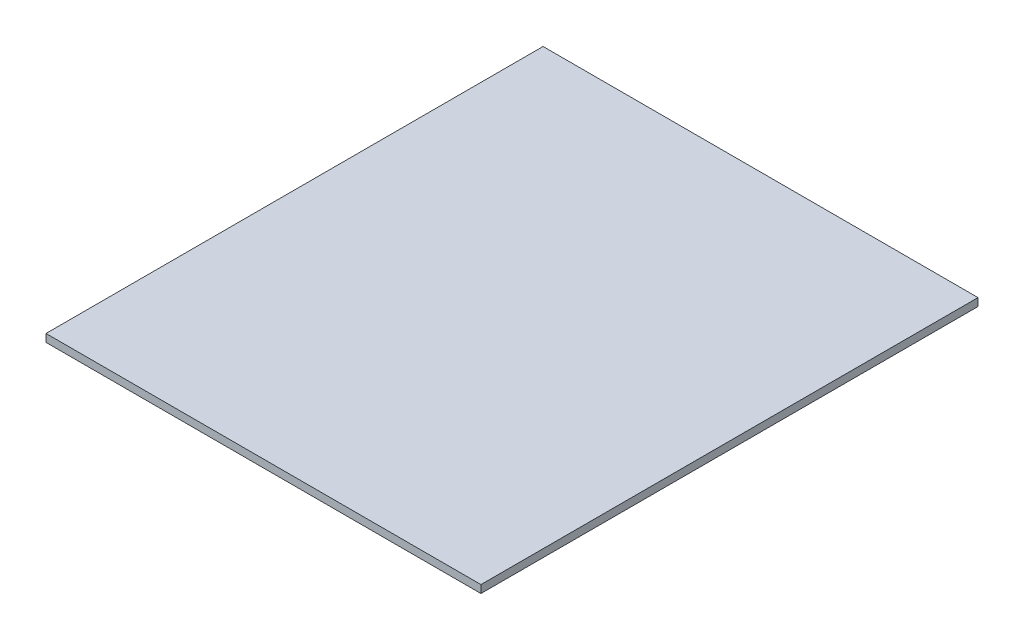
from build123d import *

# Parameters (mm, degrees)
SKETCH1_W           = 355.6
SKETCH1_H           = 406.4
BOSS_EXTRUDE1_DEPTH = 6.35


with BuildPart() as part:
    # Sketch1 → Boss-Extrude1 (new body)
    with BuildSketch(Plane(origin=(0, 0, 0), x_dir=(1, 0, 0), z_dir=(0, 1, 0))):
        with Locations((177.8, 203.2)):
            Rectangle(SKETCH1_W, SKETCH1_H)
    extrude(amount=BOSS_EXTRUDE1_DEPTH)


solid = part.part
